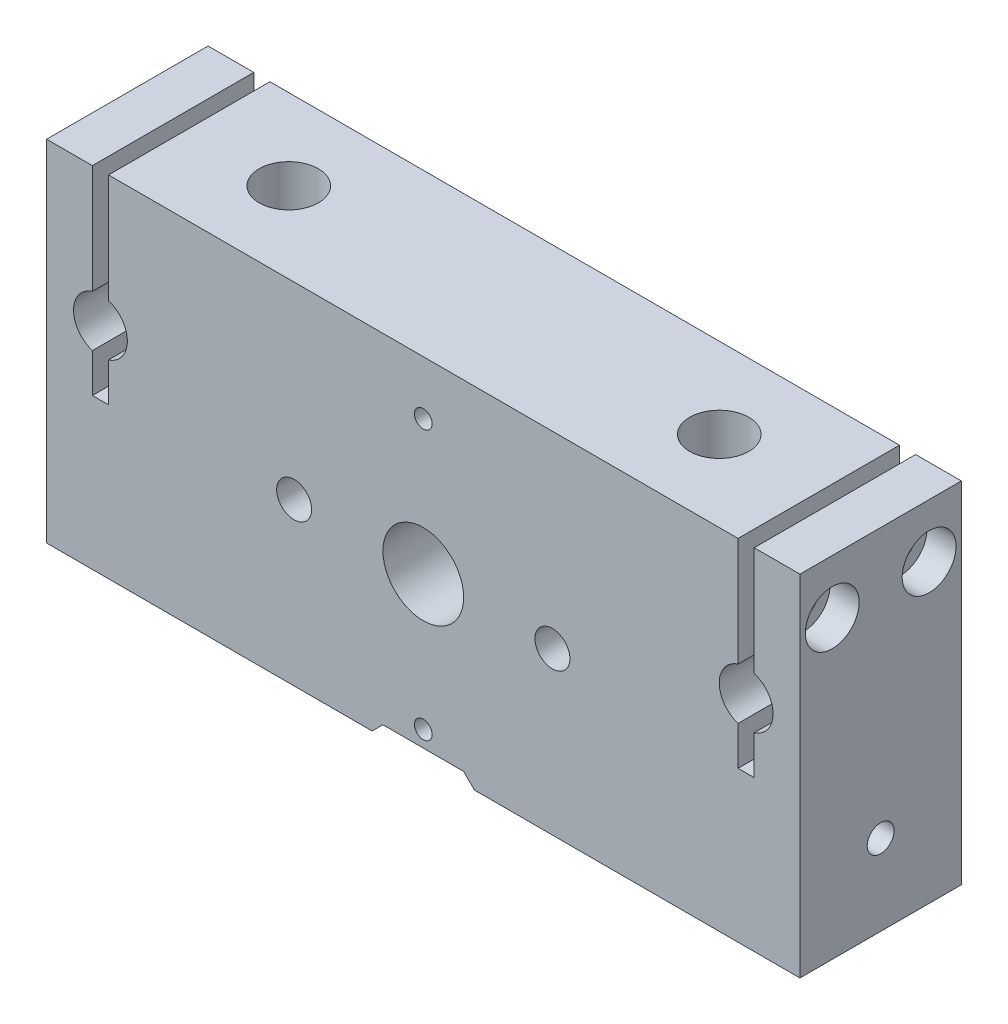
from build123d import *

# Parameters (mm, degrees)
SKETCH1_W                                           = 140
SKETCH1_H                                           = 65
BOSS_EXTRUDE1_DEPTH                                 = 30
SKETCH2_R                                           = 7.5
SKETCH2_R_2                                         = 3.25
CUT_EXTRUDE2_DEPTH                                  = 27
SKETCH4_R                                           = 7.5
CUT_EXTRUDE3_DEPTH                                  = 82.76337811
SKETCH5_R                                           = 5
CUT_EXTRUDE4_DEPTH                                  = 83.802475808
SKETCH6_W                                           = 3
SKETCH6_H                                           = 37
CUT_EXTRUDE5_DEPTH                                  = 83.802475808
CBORE_FOR_M5_HEX_SOCKET_HEAD_CAP_SCREW1_D           = 5.5
CBORE_FOR_M5_HEX_SOCKET_HEAD_CAP_SCREW1_DEPTH       = 8.5
CBORE_FOR_M5_HEX_SOCKET_HEAD_CAP_SCREW1_CBORE_D     = 10
CBORE_FOR_M5_HEX_SOCKET_HEAD_CAP_SCREW1_CBORE_DEPTH = 5.4
TAP_DRILL_FOR_M5_TAP1_AT_2_COUNT                    = 2
TAP_DRILL_FOR_M5_TAP1_AT_2_PITCH                    = 18
CBORE_FOR_M6_HEX_SOCKET_HEAD_CAP_SCREW3_D           = 6.6
CBORE_FOR_M6_HEX_SOCKET_HEAD_CAP_SCREW3_CBORE_D     = 11
CBORE_FOR_M6_HEX_SOCKET_HEAD_CAP_SCREW3_CBORE_DEPTH = 61.4
CIRPATTERN1_COUNT                                   = 4
SKETCH29_W                                          = 35
SKETCH29_H                                          = 2
CUT_EXTRUDE6_DEPTH                                  = 83.802475808
CHAMFER2_SIZE                                       = 10
SKETCH2_2_R                                         = 7.5
SKETCH2_2_R_2                                       = 3.25
CUT_EXTRUDE7_DEPTH                                  = 83.802475808


with BuildPart() as part:
    # Sketch1 → Boss-Extrude1 (new body)
    with BuildSketch(Plane.XY):
        Rectangle(SKETCH1_W, SKETCH1_H)
    extrude(amount=BOSS_EXTRUDE1_DEPTH)

    # Sketch2 → Cut-Extrude2 (cut)
    with BuildSketch(Plane(origin=(0, 0, 30), x_dir=(-1, 0, 0), z_dir=(0, 0, -1))):
        with Locations((0, -2.5)):
            Circle(SKETCH2_R)
        with Locations((24, -2.5)):
            Circle(SKETCH2_R_2)
        with Locations(Location((-24, -2.5, 0), (0, 0, 180))):
            Circle(SKETCH2_R_2)
    extrude(amount=CUT_EXTRUDE2_DEPTH, mode=Mode.SUBTRACT)

    # Sketch4 → Cut-Extrude3 (cut, through all)
    with BuildSketch(Plane.XY.offset(3)):
        with Locations((0, -2.5)):
            Circle(SKETCH4_R)
    extrude(amount=-CUT_EXTRUDE3_DEPTH, mode=Mode.SUBTRACT)

    # Sketch5 → Cut-Extrude4 (cut, through all)
    with BuildSketch(Plane(origin=(0, 0, 0), x_dir=(-1, 0, 0), z_dir=(0, 0, -1))):
        with Locations((-60, 7.5)):
            Circle(SKETCH5_R)
        with Locations((60, 7.5)):
            Circle(SKETCH5_R)
    extrude(amount=-CUT_EXTRUDE4_DEPTH, mode=Mode.SUBTRACT)

    # Sketch6 → Cut-Extrude5 (cut, through all)
    with BuildSketch(Plane(origin=(0, 0, 0), x_dir=(-1, 0, 0), z_dir=(0, 0, -1))):
        with Locations((-60, 14)):
            Rectangle(SKETCH6_W, SKETCH6_H)
        with Locations((60, 14)):
            Rectangle(SKETCH6_W, SKETCH6_H)
    extrude(amount=-CUT_EXTRUDE5_DEPTH, mode=Mode.SUBTRACT)

    # CBORE for M5 Hex Socket Head Cap Screw1
    with Locations(Plane(origin=(70, 0, 0), x_dir=(0, 0, -1), z_dir=(1, 0, 0))):
        with Locations((-6, 22.5), (-24, 22.5)):
            cbore_for_m5_hex_socket_head_cap_screw1 = CounterBoreHole(CBORE_FOR_M5_HEX_SOCKET_HEAD_CAP_SCREW1_D / 2, CBORE_FOR_M5_HEX_SOCKET_HEAD_CAP_SCREW1_CBORE_D / 2, CBORE_FOR_M5_HEX_SOCKET_HEAD_CAP_SCREW1_CBORE_DEPTH, depth=CBORE_FOR_M5_HEX_SOCKET_HEAD_CAP_SCREW1_DEPTH)

    # Sketch12 → Tap Drill for M5 Tap1 (revolve, cut)
    with BuildSketch(Plane(origin=(58.5, 22.5, 6), x_dir=(0, 0, -1), z_dir=(0, 1, 0))):
        Polygon((0, 0), (0, 13.2618073), (2.1, 12), (2.1, 0), align=None)
    tap_drill_for_m5_tap1 = revolve(axis=Axis((64.85, 22.5, 6), (-1, 0, 0)), mode=Mode.SUBTRACT)

    # Tap Drill for M5 Tap1 at 2: Tap Drill for M5 Tap1 ×2
    with Locations(*[(0, 0, i * TAP_DRILL_FOR_M5_TAP1_AT_2_PITCH) for i in range(1, TAP_DRILL_FOR_M5_TAP1_AT_2_COUNT)]):
        add(tap_drill_for_m5_tap1, mode=Mode.SUBTRACT)

    # Sketch15 → Tap Drill for M6 Tap1 (revolve, cut)
    with BuildSketch(Plane(origin=(70, -17.5, 15), x_dir=(0, 0, -1), z_dir=(0, 1, 0))):
        Polygon((0, 0), (0, 16.502151548), (2.5, 15), (2.5, 0), align=None)
    tap_drill_for_m6_tap1 = revolve(axis=Axis((76.35, -17.5, 15), (-1, 0, 0)), mode=Mode.SUBTRACT)

    # Mirror1: CBORE for M5 Hex Socket Head Cap Screw1, Tap Drill for M5 Tap1, Tap Drill for M6 Tap1 across plane
    add(cbore_for_m5_hex_socket_head_cap_screw1.mirror(Plane(origin=(0, 0, 0), x_dir=(0, 0, 1), z_dir=(1, 0, 0))), mode=Mode.SUBTRACT)
    add(tap_drill_for_m5_tap1.mirror(Plane(origin=(0, 0, 0), x_dir=(0, 0, 1), z_dir=(1, 0, 0))), mode=Mode.SUBTRACT)
    add(tap_drill_for_m6_tap1.mirror(Plane(origin=(0, 0, 0), x_dir=(0, 0, 1), z_dir=(1, 0, 0))), mode=Mode.SUBTRACT)

    # Mirror1 copy 1 sketch → Mirror1 copy 1 (revolve, cut)
    with BuildSketch(Plane(origin=(-58.5, 22.5, 24), x_dir=(0, 0, -1), z_dir=(0, 1, 0))):
        Polygon((0, 0), (0, -13.2618073), (2.1, -12), (2.1, 0), align=None)
    revolve(axis=Axis((-64.85, 22.5, 24), (-1, 0, 0)), mode=Mode.SUBTRACT)

    # CBORE for M6 Hex Socket Head Cap Screw3 (through all)
    with Locations(Plane(origin=(0, 32.5, 0), x_dir=(1, 0, 0), z_dir=(0, 1, 0))):
        with Locations((40, -15), (-40, -15)):
            CounterBoreHole(CBORE_FOR_M6_HEX_SOCKET_HEAD_CAP_SCREW3_D / 2, CBORE_FOR_M6_HEX_SOCKET_HEAD_CAP_SCREW3_CBORE_D / 2, CBORE_FOR_M6_HEX_SOCKET_HEAD_CAP_SCREW3_CBORE_DEPTH)

    # Sketch28 → Tap Drill for M4 Tap1 (revolve, cut)
    with BuildSketch(Plane(origin=(0, 22.5, 30), x_dir=(0, -1, 0), z_dir=(1, 0, 0))):
        Polygon((0, 0), (0, 8.991420021), (1.65, 8), (1.65, 0), align=None)
    tap_drill_for_m4_tap1 = revolve(axis=Axis((0, 22.5, 36.35), (0, 0, -1)), mode=Mode.SUBTRACT)

    # CirPattern1: Tap Drill for M4 Tap1 ×4 about axis, 2 skipped
    cirpattern1_axis = Axis((0, -2.5, 3), (0, 0, 1))
    add([tap_drill_for_m4_tap1.rotate(cirpattern1_axis, i * 360 / CIRPATTERN1_COUNT) for i in range(1, CIRPATTERN1_COUNT) if i not in (1, 3)], mode=Mode.SUBTRACT)

    # Sketch29 → Cut-Extrude6 (cut, through all)
    with BuildSketch(Plane.XY.offset(30)):
        with Locations((0, -31.5)):
            Rectangle(SKETCH29_W, SKETCH29_H)
    extrude(amount=-CUT_EXTRUDE6_DEPTH, mode=Mode.SUBTRACT)

    # Chamfer2
    # the kernel refuses this chamfer: 10 mm, written as the material it adds along each edge
    with BuildSketch(Plane(origin=(-17.5, -30.5, 30), x_dir=(-0.02749587661058977, -0.9996219169112965, 0), z_dir=(0, 0, -1))) as chamfer2_piece_1_section:
        Polygon((CHAMFER2_SIZE * 0.999621916911, -CHAMFER2_SIZE * 0.0274958766106), (-CHAMFER2_SIZE * 0.0274958766106, -CHAMFER2_SIZE * 0.999621916911), (0, 0), align=None)
    chamfer2_piece_1 = extrude(amount=30, mode=Mode.PRIVATE)
    chamfer2_piece_1 = split(chamfer2_piece_1, bisect_by=Plane(origin=(-12.880949734, -32.5, 15), z_dir=(0, 1, 0)), keep=Keep.TOP, mode=Mode.PRIVATE)
    add(chamfer2_piece_1)
    with BuildSketch(Plane(origin=(17.5, -30.5, 30), x_dir=(-0.9996219169112968, 0.027495876610586317, 0), z_dir=(0, 0, -1))) as chamfer2_piece_2_section:
        Polygon((CHAMFER2_SIZE * 0.999621916911, -CHAMFER2_SIZE * 0.0274958766106), (-CHAMFER2_SIZE * 0.0274958766106, -CHAMFER2_SIZE * 0.999621916911), (0, 0), align=None)
    chamfer2_piece_2 = extrude(amount=30, mode=Mode.PRIVATE)
    chamfer2_piece_2 = split(chamfer2_piece_2, bisect_by=Plane(origin=(12.880949734, -32.5, 15), z_dir=(0, 1, 0)), keep=Keep.TOP, mode=Mode.PRIVATE)
    add(chamfer2_piece_2)

    # Sketch2<2> → Cut-Extrude7 (cut, through all)
    with BuildSketch(Plane(origin=(0, 0, 30), x_dir=(-1, 0, 0), z_dir=(0, 0, -1))):
        with Locations(Location((0, -2.5, 0), (0, 0, 180))):
            Circle(SKETCH2_2_R)
        with Locations((24, -2.5)):
            Circle(SKETCH2_2_R_2)
        with Locations(Location((-24, -2.5, 0), (0, 0, 180))):
            Circle(SKETCH2_2_R_2)
    extrude(amount=CUT_EXTRUDE7_DEPTH, mode=Mode.SUBTRACT)


solid = part.part
